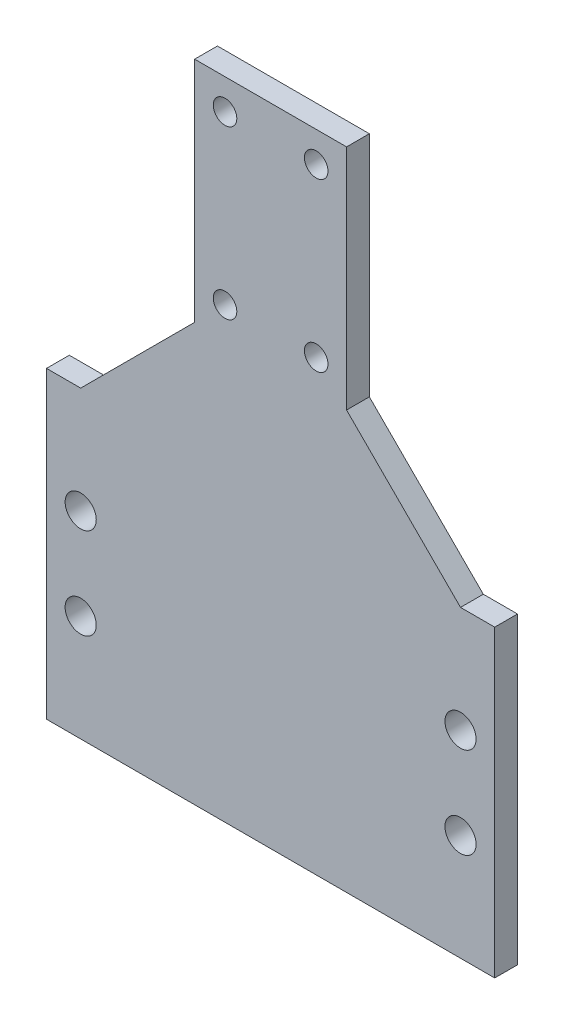
from build123d import *

# Parameters (mm, degrees)
EXTRUDE_1_DEPTH     = 3
SKETCH_2_R          = 1.55
CUT_EXTRUDE_1_DEPTH = 92.050809991
SKETCH_3_R          = 2.05
CUT_EXTRUDE_2_DEPTH = 92.050809991
SKETCH_4_W          = 3
SKETCH_4_H          = 40.476527492
CUT_EXTRUDE_3_DEPTH = 10


with BuildPart() as part:
    # 草图1 → 凸台-拉伸1 (new body)
    with BuildSketch(Plane.XY):
        Polygon((-32.5, 40), (-25, 40), (-10, 55), (-10, 85), (10, 85), (10, 55), (25, 40), (32.5, 40), (32.5, 0), (-32.5, 0), align=None)
    extrude(amount=EXTRUDE_1_DEPTH)

    # 草图2 → 切除-拉伸1 (cut, through all)
    with BuildSketch(Plane.XY.offset(3)):
        with Locations((-6, 81)):
            Circle(SKETCH_2_R)
        with Locations((-6, 59)):
            Circle(SKETCH_2_R)
        with Locations((6, 59)):
            Circle(SKETCH_2_R)
        with Locations((6, 81)):
            Circle(SKETCH_2_R)
    extrude(amount=-CUT_EXTRUDE_1_DEPTH, mode=Mode.SUBTRACT)

    # 草图3 → 切除-拉伸2 (cut, through all)
    with BuildSketch(Plane.XY.offset(3)):
        with Locations((-25, 26)):
            Circle(SKETCH_3_R)
        with Locations((-25, 14)):
            Circle(SKETCH_3_R)
        with Locations((25, 14)):
            Circle(SKETCH_3_R)
        with Locations((25, 26)):
            Circle(SKETCH_3_R)
    extrude(amount=-CUT_EXTRUDE_2_DEPTH, mode=Mode.SUBTRACT)

    # 草图4 → 切除-拉伸3 (cut)
    with BuildSketch(Plane.XY.offset(3)):
        with Locations((31, 19.761736254)):
            Rectangle(SKETCH_4_W, SKETCH_4_H)
        with Locations((-31, 19.761736254)):
            Rectangle(SKETCH_4_W, SKETCH_4_H)
    extrude(amount=-CUT_EXTRUDE_3_DEPTH, mode=Mode.SUBTRACT)


solid = part.part
